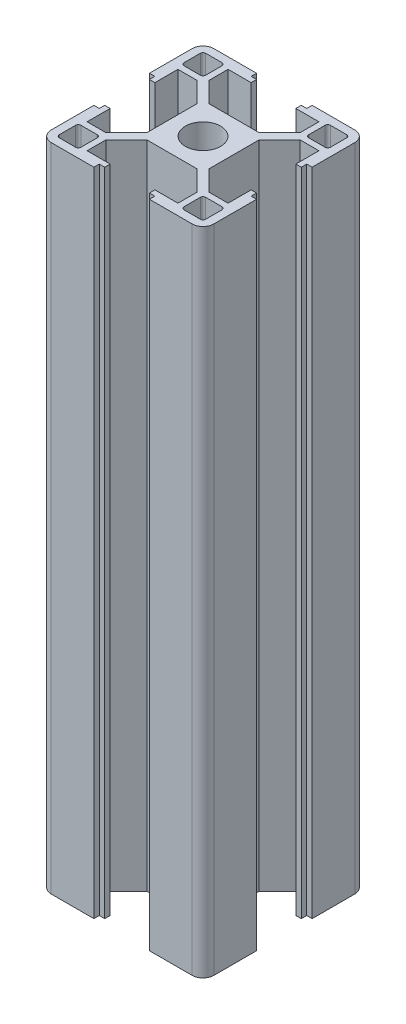
from build123d import *

# Parameters (mm, degrees)
SKETCH1_W           = 4
SKETCH1_H           = 4
SKETCH1_R           = 3.25
BOSS_EXTRUDE1_DEPTH = 120
SKETCH2_W           = 1
SKETCH2_H           = 1
CUT_EXTRUDE1_DEPTH  = 122.86057607
FILLET1_R           = 0.5


with BuildPart() as part:
    # Sketch1 → Boss-Extrude1 (new body)
    with BuildSketch(Plane(origin=(0, 0, 0), x_dir=(1, 0, 0), z_dir=(0, 1, 0))):
        with BuildLine():
            Line((-8.375, 9.50637085), (-8.375, 13))
            Line((-8.375, 13), (-4.125, 13))
            Line((-4.125, 13), (-4.125, 15))
            Line((-4.125, 15), (-13, 15))
            ThreePointArc((-13, 15), (-14.414213562, 14.414213562), (-15, 13))
            Line((-15, 13), (-15, 4.125))
            Line((-15, 4.125), (-13, 4.125))
            Line((-13, 4.125), (-13, 8.375))
            Line((-13, 8.375), (-9.50637085, 8.375))
            Line((-9.50637085, 8.375), (-5.75, 4.61862915))
            Line((-5.75, 4.61862915), (-5.75, -4.61862915))
            Line((-5.75, -4.61862915), (-9.50637085, -8.375))
            Line((-9.50637085, -8.375), (-13, -8.375))
            Line((-13, -8.375), (-13, -4.125))
            Line((-13, -4.125), (-15, -4.125))
            Line((-15, -4.125), (-15, -13))
            ThreePointArc((-15, -13), (-14.414213562, -14.414213562), (-13, -15))
            Line((-13, -15), (-4.125, -15))
            Line((-4.125, -15), (-4.125, -13))
            Line((-4.125, -13), (-8.375, -13))
            Line((-8.375, -13), (-8.375, -9.50637085))
            Line((-8.375, -9.50637085), (-4.61862915, -5.75))
            Line((-4.61862915, -5.75), (4.61862915, -5.75))
            Line((4.61862915, -5.75), (8.375, -9.50637085))
            Line((8.375, -9.50637085), (8.375, -13))
            Line((8.375, -13), (4.125, -13))
            Line((4.125, -13), (4.125, -15))
            Line((4.125, -15), (13, -15))
            ThreePointArc((13, -15), (14.414213562, -14.414213562), (15, -13))
            Line((15, -13), (15, -4.125))
            Line((15, -4.125), (13, -4.125))
            Line((13, -4.125), (13, -8.375))
            Line((13, -8.375), (9.50637085, -8.375))
            Line((9.50637085, -8.375), (5.75, -4.61862915))
            Line((5.75, -4.61862915), (5.75, 4.61862915))
            Line((5.75, 4.61862915), (9.50637085, 8.375))
            Line((9.50637085, 8.375), (13, 8.375))
            Line((13, 8.375), (13, 4.125))
            Line((13, 4.125), (15, 4.125))
            Line((15, 4.125), (15, 13))
            ThreePointArc((15, 13), (14.414213562, 14.414213562), (13, 15))
            Line((13, 15), (4.125, 15))
            Line((4.125, 15), (4.125, 13))
            Line((4.125, 13), (8.375, 13))
            Line((8.375, 13), (8.375, 9.50637085))
            Line((8.375, 9.50637085), (4.61862915, 5.75))
            Line((4.61862915, 5.75), (-4.61862915, 5.75))
            Line((-4.61862915, 5.75), (-8.375, 9.50637085))
        make_face()
        with Locations((-11.5, -11.5)):
            Rectangle(SKETCH1_W, SKETCH1_H, mode=Mode.SUBTRACT)
        with Locations((11.5, -11.5)):
            Rectangle(SKETCH1_W, SKETCH1_H, mode=Mode.SUBTRACT)
        Polygon((-9.5, 9.5), (-10.63137085, 9.5), (-13.5, 9.5), (-13.5, 13.5), (-9.5, 13.5), align=None, mode=Mode.SUBTRACT)
        Circle(SKETCH1_R, mode=Mode.SUBTRACT)
        with Locations((11.5, 11.5)):
            Rectangle(SKETCH1_W, SKETCH1_H, mode=Mode.SUBTRACT)
    extrude(amount=BOSS_EXTRUDE1_DEPTH)

    # Sketch2 → Cut-Extrude1 (cut, through all)
    with BuildSketch(Plane(origin=(0, 120, 0), x_dir=(1, 0, 0), z_dir=(0, 1, 0))):
        with Locations((14.5, 4.625)):
            Rectangle(SKETCH2_W, SKETCH2_H)
        with Locations((-4.625, 14.5)):
            Rectangle(SKETCH2_W, SKETCH2_H)
        with Locations((4.625, 14.5)):
            Rectangle(SKETCH2_W, SKETCH2_H)
        with Locations((14.5, -4.625)):
            Rectangle(SKETCH2_W, SKETCH2_H)
        with Locations((4.625, -14.5)):
            Rectangle(SKETCH2_W, SKETCH2_H)
        with Locations((-4.625, -14.5)):
            Rectangle(SKETCH2_W, SKETCH2_H)
        with Locations((-14.5, -4.625)):
            Rectangle(SKETCH2_W, SKETCH2_H)
        with Locations((-14.5, 4.625)):
            Rectangle(SKETCH2_W, SKETCH2_H)
    extrude(amount=-CUT_EXTRUDE1_DEPTH, mode=Mode.SUBTRACT)

    # Fillet1
    fillet1_edges = [part.edges().sort_by_distance(p)[0] for p in [
        (9.5, 60, 13.5),
        (-13.5, 60, 13.5),
        (-13.5, 60, -9.5),
        (9.5, 60, -9.5),
        (-13.5, 60, 9.5),
        (9.5, 60, 9.5),
        (9.5, 60, -13.5),
        (-13.5, 60, -13.5),
        (-9.5, 60, -13.5),
        (13.5, 60, -13.5),
        (13.5, 60, 9.5),
        (-9.5, 60, 9.5),
        (13.5, 60, 13.5),
        (-9.5, 60, 13.5),
        (-9.5, 60, -9.5),
        (13.5, 60, -9.5),
    ]]
    fillet(fillet1_edges, radius=FILLET1_R)


solid = part.part
